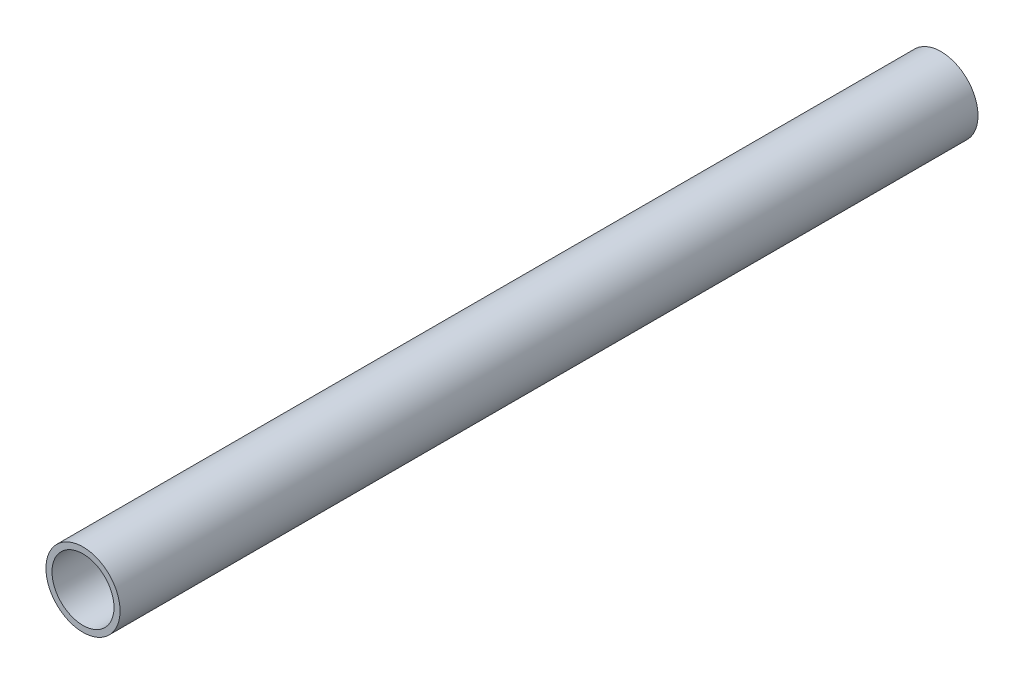
from build123d import *

# Parameters (mm, degrees)
SKETCH1_R           = 24.13
SKETCH1_R_2         = 20.193
BOSS_EXTRUDE1_DEPTH = 558.8


with BuildPart() as part:
    # Sketch1 → Boss-Extrude1 (new body)
    with BuildSketch(Plane.XY):
        Circle(SKETCH1_R)
        Circle(SKETCH1_R_2, mode=Mode.SUBTRACT)
    extrude(amount=BOSS_EXTRUDE1_DEPTH)


solid = part.part
